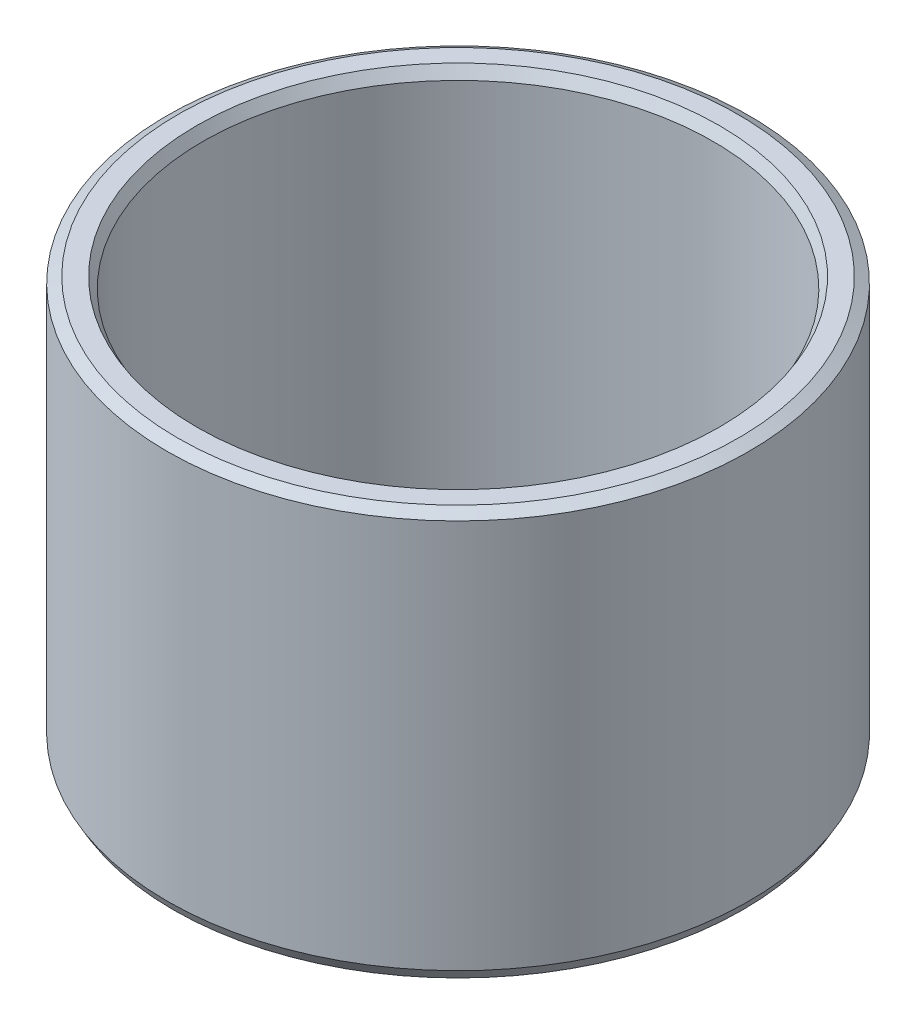
from build123d import *
from OCP.BRepFilletAPI import BRepFilletAPI_MakeChamfer

# Parameters (mm, degrees)
SKETCH1_R           = 52.5
BOSS_EXTRUDE1_DEPTH = 73.321610356
SKETCH2_R           = 46.039225713
CUT_EXTRUDE1_DEPTH  = 105.348256072
CHAMFER1_SIZE       = 1.112387906
CHAMFER1_SIZE2      = 1.92671237


with BuildPart() as part:
    # Sketch1 → Boss-Extrude1 (new body)
    with BuildSketch(Plane(origin=(0, 0, 0), x_dir=(1, 0, 0), z_dir=(0, 1, 0))):
        Circle(SKETCH1_R)
    extrude(amount=BOSS_EXTRUDE1_DEPTH)

    # Sketch2 → Cut-Extrude1 (cut, through all)
    with BuildSketch(Plane(origin=(0, 0, 0), x_dir=(1, 0, 0), z_dir=(0, 1, 0))):
        Circle(SKETCH2_R)
    extrude(amount=CUT_EXTRUDE1_DEPTH, mode=Mode.SUBTRACT)

    # Chamfer1: one chamfer whose edges measure the first distance from different faces: ONE call of the kernel's chamfer builder (chamfer() names one face for all edges)
    chamfer1_edges_1 = [part.edges().sort_by_distance(p)[0] for p in [
        (-46.039225713, 73.321610356, 0),
    ]]
    chamfer1_side_1 = [part.faces().sort_by_distance(p)[0] for p in [
        (-51.01507576, 73.321610356, 0),
    ]]
    chamfer1_edges_2 = [part.edges().sort_by_distance(p)[0] for p in [
        (-46.039225713, 0, 0),
    ]]
    chamfer1_side_2 = [part.faces().sort_by_distance(p)[0] for p in [
        (-46.039225713, 36.660805178, 0),
    ]]
    chamfer1_edges_3 = [part.edges().sort_by_distance(p)[0] for p in [
        (-52.5, 0, 0),
    ]]
    chamfer1_side_3 = [part.faces().sort_by_distance(p)[0] for p in [
        (-51.01507576, 0, 0),
    ]]
    chamfer1_edges_4 = [part.edges().sort_by_distance(p)[0] for p in [
        (-52.5, 73.321610356, 0),
    ]]
    chamfer1_side_4 = [part.faces().sort_by_distance(p)[0] for p in [
        (-52.5, 36.660805178, 0),
    ]]
    chamfer1 = BRepFilletAPI_MakeChamfer(part.part.solid().wrapped)
    for e in chamfer1_edges_1:
        chamfer1.Add(CHAMFER1_SIZE, CHAMFER1_SIZE2, e.wrapped, chamfer1_side_1[0].wrapped)  # the first distance lies on this face
    for e in chamfer1_edges_2:
        chamfer1.Add(CHAMFER1_SIZE, CHAMFER1_SIZE2, e.wrapped, chamfer1_side_2[0].wrapped)  # the first distance lies on this face
    for e in chamfer1_edges_3:
        chamfer1.Add(CHAMFER1_SIZE, CHAMFER1_SIZE2, e.wrapped, chamfer1_side_3[0].wrapped)  # the first distance lies on this face
    for e in chamfer1_edges_4:
        chamfer1.Add(CHAMFER1_SIZE, CHAMFER1_SIZE2, e.wrapped, chamfer1_side_4[0].wrapped)  # the first distance lies on this face
    add(Compound.cast(chamfer1.Shape()), mode=Mode.REPLACE)


solid = part.part
